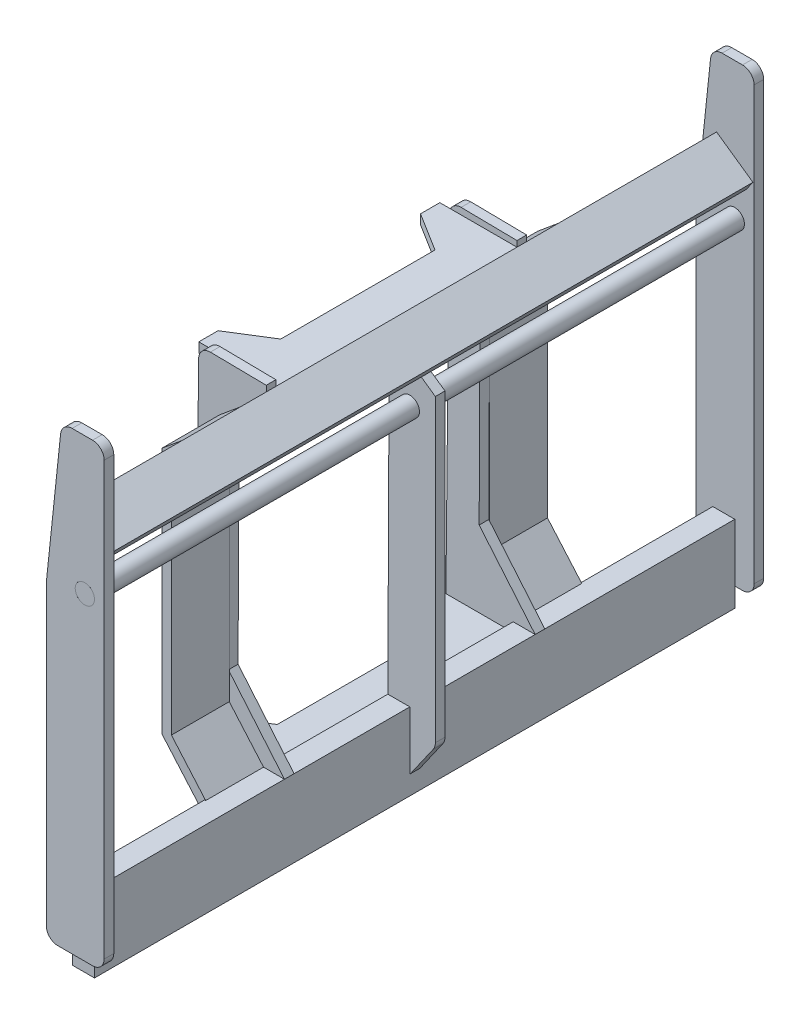
from build123d import *

# Parameters (mm, degrees)
BOSS_EXTRUDE2_START  = 830
BOSS_EXTRUDE2_DEPTH  = 25
BOSS_EXTRUDE3_START  = -830
BOSS_EXTRUDE3_DEPTH  = 25
SKETCH2_W            = 57
SKETCH2_H            = 200
BOSS_EXTRUDE4_DEPTH  = 1660
BOSS_EXTRUDE5_DEPTH  = 12.5
SKETCH4_R            = 25
CUT_EXTRUDE1_DEPTH   = 2084.026644093
SKETCH5_R            = 24.99
BOSS_EXTRUDE6_DEPTH  = 1710
BOSS_EXTRUDE9_START  = 300
BOSS_EXTRUDE9_DEPTH  = 25
EXTRUDE_THIN11_DEPTH = 150
BOSS_EXTRUDE10_REACH = 1385.667
SKETCH12_W           = 150
SKETCH12_H           = 25
BOSS_EXTRUDE11_DEPTH = 25
LPATTERN1_COUNT      = 2
LPATTERN1_PITCH      = 870
FILLET1_R            = 30


with BuildPart() as part:
    # Sketch1 → Boss-Extrude2 (new body)
    with BuildSketch(Plane.XY.offset(BOSS_EXTRUDE2_START)):
        Polygon((0, 0), (0, 1180), (-110, 1180), (-150, 800), (-150, 0), align=None)
    extrude(amount=BOSS_EXTRUDE2_DEPTH)



with BuildPart() as body_2:
    # Sketch1<2> → Boss-Extrude3 (new body)
    with BuildSketch(Plane.XY.offset(BOSS_EXTRUDE3_START)):
        Polygon((0, 0), (0, 1180), (-110, 1180), (-150, 800), (-150, 0), align=None)
    extrude(amount=-BOSS_EXTRUDE3_DEPTH)


with BuildPart() as part_1:
    add(part.part)

    add(body_2.part)  # Boss-Extrude4 merges body 2
    # Sketch2 → Boss-Extrude4 (add)
    with BuildSketch(Plane.XY.offset(-830)):
        Polygon((-3, 930), (-20.207293091, 905.425438671), (-114.409778184, 971.386728852), (-97.202485093, 995.96129018), align=None)
        with Locations((-78.5, 50)):
            Rectangle(SKETCH2_W, SKETCH2_H)
    extrude(amount=BOSS_EXTRUDE4_DEPTH)

    # Sketch3 → Boss-Extrude5 (add, symmetric)
    with BuildSketch(Plane.XY):
        Polygon((-103.415345034, 963.688343882), (16.216787549, 879.921022835), (16.216787549, 93.095347735), (-48.966785029, 0.003558486), (-50, 150), (-107, 150), align=None)
    extrude(amount=BOSS_EXTRUDE5_DEPTH, both=True)

    # Sketch4 → Cut-Extrude1 (cut, through all)
    with BuildSketch(Plane.XY.offset(855)):
        with Locations((-50, 825)):
            Circle(SKETCH4_R)
    extrude(amount=-CUT_EXTRUDE1_DEPTH, mode=Mode.SUBTRACT)

    # Sketch6 → Boss-Extrude9 (add)
    with BuildSketch(Plane(origin=(0, 0, -12.5), x_dir=(-1, 0, 0), z_dir=(0, 0, -1)).offset(BOSS_EXTRUDE9_START)):
        Polygon((50, 150), (107, 150), (107.001473273, 75.493341843), (282, 75.493341843), (272.202485093, 1013.390328918), (97.202485093, 1010.96129018), (97.202485093, 995.96129018), (114.409778184, 971.386728852), (67.308535637, 938.406083762), (193.026269643, 825.209327623), (195.238333547, 323.088305787), align=None)
    boss_extrude9 = extrude(amount=BOSS_EXTRUDE9_DEPTH)

    # Sketch11 → Extrude-Thin11 (add)
    with BuildSketch(Plane(origin=(0, 0, -337.5), x_dir=(-1, 0, 0), z_dir=(0, 0, -1))):
        Polygon((112.33881046, 939.48170169), (193.097782618, 872.337456037), (193.097782618, 252.607341749), (104.152637174, 149.894006612), (123.051517504, 133.528423142), (218.097782618, 243.287295687), (218.097782618, 884.064103947), (128.321649968, 958.705354861), align=None)
    extrude_thin11 = extrude(amount=EXTRUDE_THIN11_DEPTH)

    # Sketch12 → Boss-Extrude10 (add, up to next)
    with BuildSketch(Plane(origin=(395.423561528, 328.761201919, 0), x_dir=(0, 0, -1), z_dir=(0.7689461268447529, 0.6393135803425837, 0)), mode=Mode.PRIVATE) as boss_extrude10_sk1:
        with Locations((412.5, 806.730542883)):
            Rectangle(SKETCH12_W, SKETCH12_H)
    boss_extrude10_tool1 = extrude(boss_extrude10_sk1.sketch, amount=BOSS_EXTRUDE10_REACH, mode=Mode.PRIVATE) - part_1.part
    add(boss_extrude10_tool1.solids().sort_by_distance((-120.33023, 949.093528, -412.5))[0])

    # Mirror1: Boss-Extrude9, Extrude-Thin11 across plane
    add(boss_extrude9.mirror(Plane.XY))
    add(extrude_thin11.mirror(Plane.XY))

    # Sketch13 → Boss-Extrude11 (add)
    with BuildSketch(Plane(origin=(0, 995.96129018, 0), x_dir=(1, 0, 0), z_dir=(0, 1, 0))):
        Polygon((-297.202485093, 312.5), (-97.202485093, 312.5), (-97.202485093, -312.5), (-297.202485093, -312.5), (-297.202485093, -262.5), (-197.202485093, -200), (-197.202485093, 200), (-297.202485093, 262.5), align=None)
    boss_extrude11 = extrude(amount=-BOSS_EXTRUDE11_DEPTH)

    # LPattern1: Boss-Extrude11 ×2
    with Locations(*[Vector(-0.01044568914487086, -0.9999454423008731, 0) * (i * LPATTERN1_PITCH) for i in range(1, LPATTERN1_COUNT)]):
        add(boss_extrude11)

    # Fillet1
    # the kernel refuses this fillet: 30 mm, written as the material it takes off along each edge
    with BuildSketch(Plane(origin=(-282, 75.493341843, -312.5), x_dir=(1, 0, 0), z_dir=(0, 0, -1))) as fillet1_piece_1:
        with BuildLine():
            CenterArc((FILLET1_R * 1.01050081974, -FILLET1_R), FILLET1_R, 90, 90.598504786)
            Line((FILLET1_R * 0.0105553774437, -FILLET1_R * 1.01044568914), (0, 0))
            Line((0, 0), (FILLET1_R * 1.01050081974, 0))
        make_face()
    extrude(amount=100.787561481, mode=Mode.SUBTRACT)
    with BuildSketch(Plane(origin=(-272.202485093, 1013.390328918, -312.5), x_dir=(0.9999036836445534, -0.01387888446716093, 0), z_dir=(0, 0, -1))) as fillet1_piece_2:
        with BuildLine():
            CenterArc((FILLET1_R * 1.00343935877, FILLET1_R), FILLET1_R, 179.803277751, 90.196722249)
            Line((FILLET1_R * 0.00344525305947, FILLET1_R * 1.00343344421), (0, 0))
            Line((0, 0), (FILLET1_R * 1.00343935877, 0))
        make_face()
    extrude(amount=100.257951908, mode=Mode.SUBTRACT)
    with BuildSketch(Plane(origin=(-272.202485093, 1013.390328918, 312.5), x_dir=(0.9999036836445534, -0.01387888446716093, 0), z_dir=(0, 0, 1))) as fillet1_piece_3:
        with BuildLine():
            CenterArc((FILLET1_R * 1.00343935877, -FILLET1_R), FILLET1_R, 90, 90.196722249)
            Line((FILLET1_R * 0.00344525305947, -FILLET1_R * 1.00343344421), (0, 0))
            Line((0, 0), (FILLET1_R * 1.00343935877, 0))
        make_face()
    extrude(amount=100.257951908, mode=Mode.SUBTRACT)
    with BuildSketch(Plane(origin=(-282, 75.493341843, 312.5), x_dir=(1, 0, 0), z_dir=(0, 0, 1))) as fillet1_piece_4:
        with BuildLine():
            CenterArc((FILLET1_R * 1.01050081974, FILLET1_R), FILLET1_R, 179.401495214, 90.598504786)
            Line((FILLET1_R * 0.0105553774437, FILLET1_R * 1.01044568914), (0, 0))
            Line((0, 0), (FILLET1_R * 1.01050081974, 0))
        make_face()
    extrude(amount=100.787561481, mode=Mode.SUBTRACT)
    with BuildSketch(Plane(origin=(0, 0, -755), x_dir=(-1, 0, 0), z_dir=(0, 0, -1)), Plane(origin=(0, 1180, -755), x_dir=(0, -1, 0), z_dir=(0, 0, -1)), Plane(origin=(-150, 0, 755), x_dir=(1, 0, 0), z_dir=(0, 0, 1)), Plane(origin=(0, 0, 755), x_dir=(0, 1, 0), z_dir=(0, 0, 1))) as fillet1_piece_5:
        with BuildLine():
            CenterArc((FILLET1_R, FILLET1_R), FILLET1_R, 180, 90)
            Line((0, FILLET1_R), (0, 0))
            Line((0, 0), (FILLET1_R, 0))
        make_face()
    extrude(amount=175, mode=Mode.SUBTRACT)
    with BuildSketch(Plane(origin=(-150, 0, -755), x_dir=(1, 0, 0), z_dir=(0, 0, -1)), Plane(origin=(0, 1180, 755), x_dir=(0, -1, 0), z_dir=(0, 0, 1))) as fillet1_piece_6:
        with BuildLine():
            CenterArc((FILLET1_R, -FILLET1_R), FILLET1_R, 90, 90)
            Line((0, -FILLET1_R), (0, 0))
            Line((0, 0), (FILLET1_R, 0))
        make_face()
    extrude(amount=175, mode=Mode.SUBTRACT)
    with BuildSketch(Plane(origin=(-110, 1180, -762.480369048), x_dir=(1, 0, 0), z_dir=(0, 0, -1))) as fillet1_piece_7:
        with BuildLine():
            CenterArc((FILLET1_R * 0.900261746029, FILLET1_R), FILLET1_R, 186.009005957, 83.990994043)
            Line((-FILLET1_R * 0.0942437068928, FILLET1_R * 0.895315215482), (0, 0))
            Line((0, 0), (FILLET1_R * 0.900261746029, 0))
        make_face()
    extrude(amount=160.039261904, mode=Mode.SUBTRACT)
    with BuildSketch(Plane(origin=(16.216787549, 93.095347735, 36.147409166), x_dir=(-0.5735764363510503, -0.8191520442889889, 0), z_dir=(0, 0, -1))) as fillet1_piece_8:
        with BuildLine():
            CenterArc((FILLET1_R * 0.315298788879, FILLET1_R), FILLET1_R, 235, 35)
            Line((-FILLET1_R * 0.258277647472, FILLET1_R * 0.180847955711), (0, 0))
            Line((0, 0), (FILLET1_R * 0.315298788879, 0))
        make_face()
    extrude(amount=72.294818332, mode=Mode.SUBTRACT)
    with BuildSketch(Plane(origin=(-110, 1180, 762.480369048), x_dir=(1, 0, 0), z_dir=(0, 0, 1))) as fillet1_piece_9:
        with BuildLine():
            CenterArc((FILLET1_R * 0.900261746029, -FILLET1_R), FILLET1_R, 90, 83.990994043)
            Line((-FILLET1_R * 0.0942437068928, -FILLET1_R * 0.895315215482), (0, 0))
            Line((0, 0), (FILLET1_R * 0.900261746029, 0))
        make_face()
    extrude(amount=160.039261904, mode=Mode.SUBTRACT)


with BuildPart() as body_2_2:
    # Sketch5 → Boss-Extrude6 (new body)
    with BuildSketch(Plane.XY.offset(855)):
        with Locations((-50, 825)):
            Circle(SKETCH5_R)
    extrude(amount=-BOSS_EXTRUDE6_DEPTH)


solid = Compound([part_1.part, body_2_2.part])
